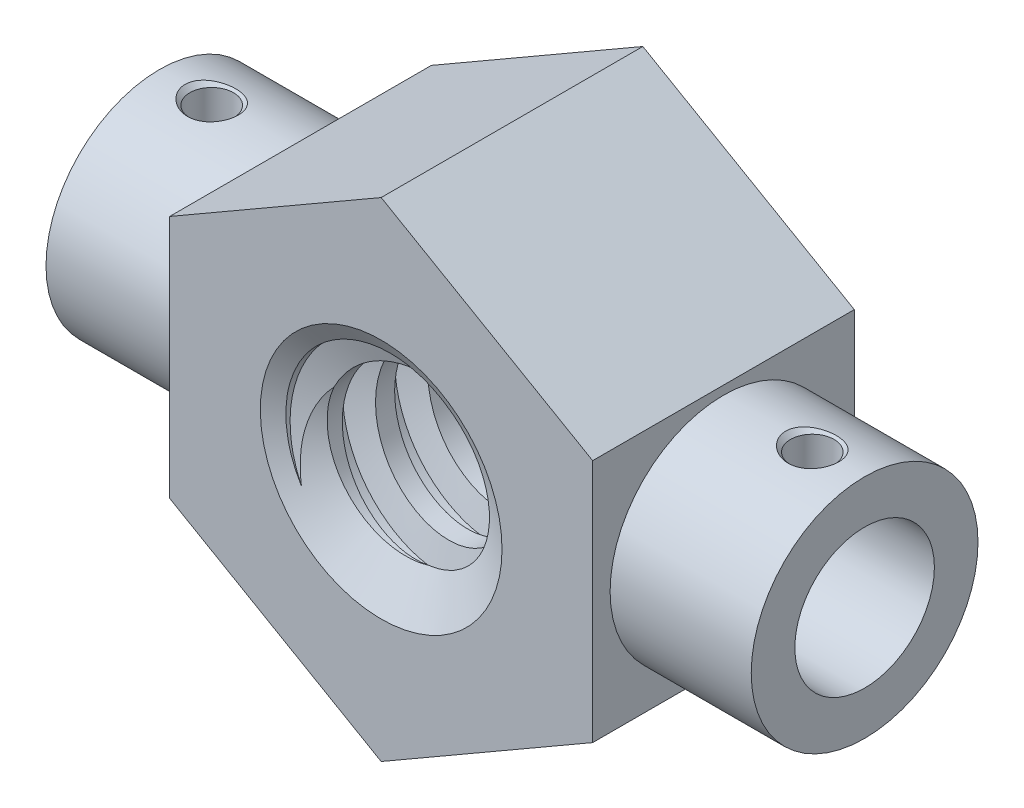
from build123d import *

# Parameters (mm, degrees)
SKETCH5_R                   = 4.25
BOSS_EXTRUDE2_DEPTH         = 30
SWEEP1_PITCH                = 3
SKETCH9_W                   = 10
SKETCH9_H                   = 15
CUT_EXTRUDE2_DEPTH          = 26.406692205
CUT_EXTRUDE2_DEPTH_BACK     = 26.406692205
SKETCH10_R                  = 17.5
SKETCH13_R                  = 6.5
SKETCH13_R_2                = 4
BOSS_EXTRUDE3_DEPTH         = 8.090644347
CUT_EXTRUDE3_DEPTH          = 10
M3_TAPPED_HOLE2_D           = 2.5
M3_TAPPED_HOLE2_DEPTH       = 6
M3_TAPPED_HOLE2_CSINK_D     = 3.05
M3_TAPPED_HOLE2_CSINK_ANGLE = 90
M3_TAPPED_HOLE2_TIP         = 0.751075774


with BuildPart() as part:
    # Sketch5 → Boss-Extrude2 (new body)
    with BuildSketch(Plane.XY):
        Circle(SKETCH5_R)
    extrude(amount=-BOSS_EXTRUDE2_DEPTH)

    # Sweep1: the profile of Sketch8 profile screwed along a right-hand helix of 7.333333 turns, 10 arcs to a turn; built about Z, then put on its axis
    sweep1_z = Axis((0, 0, 0), (0, 0, 1))
    sweep1_corners = [(4.2497, 0, -1.018029577), (4.2497, 0, 1.018029577), (6, 0, 0.549038106), (6, 0, -0.549038106)]
    with BuildLine(mode=Mode.PRIVATE) as sweep1_profile:
        Line(sweep1_corners[0], sweep1_corners[1])
        Line(sweep1_corners[1], sweep1_corners[2])
        Line(sweep1_corners[2], sweep1_corners[3])
        Line(sweep1_corners[3], sweep1_corners[0])
    sweep1_cap = Face(sweep1_profile.wire())
    sweep1_turn_angles = [0, 18, 36, 54, 72, 90, 108, 126, 144, 162, 180, 198, 216, 234, 252, 270, 288, 306, 324, 342, 360]
    sweep1_turn_weights = [1, 0.9510565162951535, 1, 0.9510565162951535, 1, 0.9510565162951535, 1, 0.9510565162951535, 1, 0.9510565162951535, 1, 0.9510565162951535, 1, 0.9510565162951535, 1, 0.9510565162951535, 1, 0.9510565162951535, 1, 0.9510565162951535, 1]
    sweep1_turn_rails = [Edge.make_bspline([Vector(p[0], p[1], 0).rotate(sweep1_z, sweep1_turn_angles[k]) / sweep1_turn_weights[k] + Vector(0, 0, p[2] + SWEEP1_PITCH * sweep1_turn_angles[k] / 360) for k in range(21)], [0, 0, 0, 1, 1, 2, 2, 3, 3, 4, 4, 5, 5, 6, 6, 7, 7, 8, 8, 9, 9, 10, 10, 10], 2, sweep1_turn_weights) for p in sweep1_corners]
    sweep1_turn_sides = [Face.make_surface_from_curves(sweep1_turn_rails[p[0]], sweep1_turn_rails[p[1]]) for p in [(0, 1), (1, 2), (2, 3), (3, 0)]]
    sweep1_last_angles = [2520, 2538, 2556, 2574, 2592, 2610, 2628, 2634, 2640]
    sweep1_last_weights = [1, 0.9510565162951535, 1, 0.9510565162951535, 1, 0.9510565162951535, 1, 0.9945218953682742, 1]
    sweep1_last_rails = [Edge.make_bspline([Vector(p[0], p[1], 0).rotate(sweep1_z, sweep1_last_angles[k]) / sweep1_last_weights[k] + Vector(0, 0, p[2] + SWEEP1_PITCH * sweep1_last_angles[k] / 360) for k in range(9)], [0, 0, 0, 1, 1, 2, 2, 3, 3, 4, 4, 4], 2, sweep1_last_weights) for p in sweep1_corners]
    sweep1_last_sides = [Face.make_surface_from_curves(sweep1_last_rails[p[0]], sweep1_last_rails[p[1]]) for p in [(0, 1), (1, 2), (2, 3), (3, 0)]]
    sweep1 = Plane(origin=(0, 0, 0), x_dir=(0, 1, 0), z_dir=(0, 0, -1)) * Solid(Shell([*[p.moved(Location((0, 0, SWEEP1_PITCH * i))) for i in range(7) for p in sweep1_turn_sides], *sweep1_last_sides, sweep1_cap, sweep1_cap.rotate(sweep1_z, 2640).moved(Location((0, 0, SWEEP1_PITCH * 2640 / 360)))]))
    add(sweep1)


with BuildPart() as body_2:
    # Sketch9 → Revolve1 (revolve)
    with BuildSketch(Plane(origin=(0, 0, 0), x_dir=(1, 0, 0), z_dir=(0, 1, 0))):
        with Locations((9.5, 9.5)):
            Rectangle(SKETCH9_W, SKETCH9_H)
    revolve(axis=Axis((0, 0, 0), (0, 0, -1)))

    # Combine1: cut part
    add(part.part, mode=Mode.SUBTRACT)

    # Sketch10 → Cut-Extrude2 (cut, two sides: drawn at the far end of the back side and taken through both)
    with BuildSketch(Plane.XY.offset(-2).offset(-CUT_EXTRUDE2_DEPTH_BACK)):
        Circle(SKETCH10_R)
        Polygon((0, 14), (-12.124355653, 7), (-12.124355653, -7), (0, -14), (12.124355653, -7), (12.124355653, 7), align=None, mode=Mode.SUBTRACT)
    extrude(amount=CUT_EXTRUDE2_DEPTH + CUT_EXTRUDE2_DEPTH_BACK, mode=Mode.SUBTRACT)

    # Sketch11 → Cut-Revolve1 (revolve, cut)
    with BuildSketch(Plane(origin=(0, 0, 0), x_dir=(0, 0, -1), z_dir=(1, 0, 0)), mode=Mode.PRIVATE) as cut_revolve1_sk:
        Polygon((-1.618802154, 0), (6, 0), (1.381197846, 8), (-1.618802154, 8), align=None)
    cut_revolve1 = revolve(cut_revolve1_sk.sketch.rotate(Axis((0, 0, 1.618802154), (0, 0, -1)), 162.340615897), axis=Axis((0, 0, 1.618802154), (0, 0, -1)), mode=Mode.SUBTRACT)

    # Mirror1: Cut-Revolve1 across plane
    add(cut_revolve1.mirror(Plane.XY.offset(-9.5)), mode=Mode.SUBTRACT)

    # Sketch13 → Boss-Extrude3 (add)
    with BuildSketch(Plane(origin=(20.215, 0, 0), x_dir=(0, 0, -1), z_dir=(1, 0, 0))):
        with Locations((9.5, 0)):
            Circle(SKETCH13_R)
        with Locations((9.5, 0)):
            Circle(SKETCH13_R_2, mode=Mode.SUBTRACT)
    boss_extrude3 = extrude(amount=-BOSS_EXTRUDE3_DEPTH)

    # Sketch13<2> → Cut-Extrude3 (cut)
    with BuildSketch(Plane(origin=(20.215, 0, 0), x_dir=(0, 0, -1), z_dir=(1, 0, 0))):
        with BuildLine():
            ThreePointArc((13.5, 0), (12.328427125, 2.828427125), (9.5, 4))
            Line((9.5, 4), (9.5, -4))
            ThreePointArc((9.5, -4), (12.328427125, -2.828427125), (13.5, 0))
        make_face()
        with BuildLine():
            Line((9.5, -4), (9.5, 4))
            ThreePointArc((9.5, 4), (5.5, 0), (9.5, -4))
        make_face()
    cut_extrude3 = extrude(amount=-CUT_EXTRUDE3_DEPTH, mode=Mode.SUBTRACT)

    # Mirror4: Boss-Extrude3, Cut-Extrude3 across plane
    add(boss_extrude3.mirror(Plane(origin=(0, 0, 0), x_dir=(0, 0, 1), z_dir=(1, 0, 0))))
    add(cut_extrude3.mirror(Plane(origin=(0, 0, 0), x_dir=(0, 0, 1), z_dir=(1, 0, 0))), mode=Mode.SUBTRACT)

    # M3 Tapped Hole2
    with Locations(Plane(origin=(0, 6.5, 0), x_dir=(1, 0, 0), z_dir=(0, 1, 0))):
        with Locations((-17.215, 9.5), (17.215, 9.5)):
            CounterSinkHole(M3_TAPPED_HOLE2_D / 2, M3_TAPPED_HOLE2_CSINK_D / 2, depth=M3_TAPPED_HOLE2_DEPTH, counter_sink_angle=M3_TAPPED_HOLE2_CSINK_ANGLE)
            with Locations((0, 0, -(M3_TAPPED_HOLE2_DEPTH + M3_TAPPED_HOLE2_TIP / 2))):  # 118° drill point
                Cone(0, M3_TAPPED_HOLE2_D / 2, M3_TAPPED_HOLE2_TIP, mode=Mode.SUBTRACT)


solid = body_2.part
